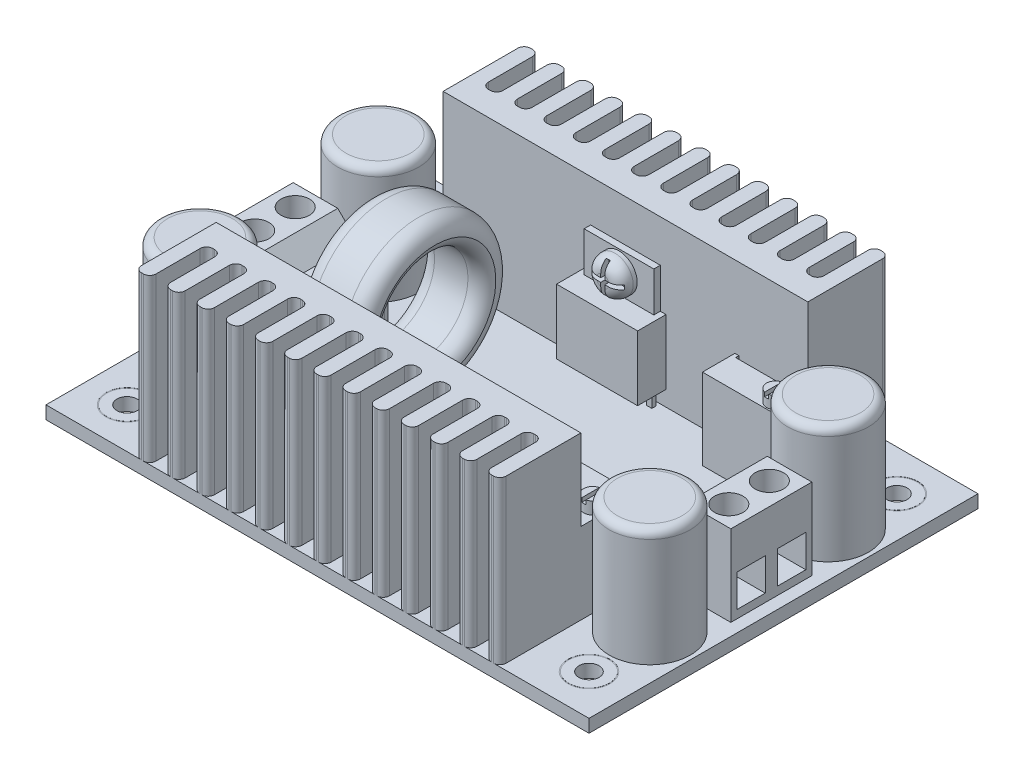
from build123d import *

# Parameters (mm, degrees)
SKETCH1_W                = 67
SKETCH1_H                = 48
BOSS_EXTRUDE1_DEPTH      = 1.6
BOSS_EXTRUDE2_DEPTH      = 20
SKETCH4_R                = 4.999999999999993
SKETCH4_R_2              = 5.000000000000001
SKETCH4_R_3              = 4.9999999999999964
BOSS_EXTRUDE3_DEPTH      = 16
FILLET1_R                = 1
SKETCH7_W                = 7.9999999999999964
SKETCH7_H                = 10
BOSS_EXTRUDE4_DEPTH      = 10
CUT_EXTRUDE1_DEPTH       = 6
CHAMFER1_SIZE            = 2.5
SKETCH9_R                = 1.7500000000000002
CUT_EXTRUDE2_DEPTH       = 6
CHAMFER1_OF_MIRROR1_SIZE = 2.5
BOSS_EXTRUDE5_DEPTH      = 10
CUT_EXTRUDE3_DEPTH       = 10
SKETCH13_R               = 1.0999999999999992
BOSS_EXTRUDE6_DEPTH      = 1.5
SKETCH14_W               = 0.5000000000000036
SKETCH14_H               = 2.4064882157904393
CUT_EXTRUDE4_DEPTH       = 0.5
SKETCH15_R               = 1.2500000000000013
CUT_EXTRUDE5_DEPTH       = 2
SKETCH17_W               = 10
SKETCH17_H               = 8
BOSS_EXTRUDE7_DEPTH      = 3.5
SKETCH19_W               = 0.8000000000000025
SKETCH19_H               = 4.916845402432045
BOSS_EXTRUDE8_DEPTH      = 10
BOSS_EXTRUDE9_DEPTH      = 2
FILLET2_R                = 1.5
CUT_EXTRUDE6_DEPTH       = 1
SKETCH23_W               = 0.6909441831031033
SKETCH23_H               = 0.5
SKETCH23_W_2             = 0.6909441831031198
BOSS_EXTRUDE10_DEPTH     = 4.5
SKETCH25_W               = 0.8000000000000025
SKETCH25_H               = 4.916845402432045
CUT_EXTRUDE7_DEPTH       = 0.7
LPATTERN2_COUNT          = 2
LPATTERN2_PITCH          = 9.3
MIRROR4_START            = -14
MIRROR4_OUTLINE_W        = 10
MIRROR4_OUTLINE_H        = 8
MIRROR4_DEPTH            = 3.5
MIRROR4_2_OUTLINE_R      = 2.25
MIRROR4_2_DEPTH          = 2.8
MIRROR4_3_OUTLINE_W      = 8.6
MIRROR4_3_OUTLINE_H      = 4.916845402
MIRROR4_3_OUTLINE_R      = 2.25
MIRROR4_3_DEPTH          = 0.8
MIRROR4_START_2          = -13.2
MIRROR4_4_DEPTH          = 1
MIRROR4_START_3          = -0.345472092
MIRROR4_5_OUTLINE_W      = 1.9000000000000004
MIRROR4_5_OUTLINE_H      = 0.5
MIRROR4_5_OUTLINE_W_2    = 1
MIRROR4_5_DEPTH          = 0.690944184
MIRROR4_START_4          = -4.264386214
MIRROR4_6_OUTLINE_W      = 1.9000000000000004
MIRROR4_6_OUTLINE_H      = 0.5
MIRROR4_6_OUTLINE_W_2    = 1
MIRROR4_6_DEPTH          = 0.690944183
MIRROR4_START_5          = 3.573442031
MIRROR4_7_OUTLINE_W      = 1.9000000000000004
MIRROR4_7_OUTLINE_H      = 0.5
MIRROR4_7_OUTLINE_W_2    = 1
MIRROR4_7_DEPTH          = 0.690944183
SKETCH28_R               = 9.5
SKETCH28_R_2             = 6
BOSS_EXTRUDE11_DEPTH     = 8
FILLET10_R               = 2
FILLET11_R               = 2
BOSS_EXTRUDE12_DEPTH     = 8
SKETCH32_W               = 11
SKETCH32_H               = 3.5000000000000004
BOSS_EXTRUDE13_DEPTH     = 1.1
BOSS_EXTRUDE14_DEPTH     = 0.4
BOSS_EXTRUDE14_2_DEPTH   = 0.4
LPATTERN3_COUNT          = 8
LPATTERN3_PITCH          = 1.514
BOSS_EXTRUDE15_DEPTH     = 0.4
SKETCH36_W               = 2.4999999999999964
SKETCH36_H               = 1.5
CUT_EXTRUDE8_DEPTH       = 0.2
SKETCH37_R               = 2.5999999999999983
SKETCH37_R_2             = 2.4999999999999982
CUT_EXTRUDE9_DEPTH       = 0.01
MIRROR6_START            = 1.59
MIRROR6_OUTLINE_R        = 2.6
MIRROR6_OUTLINE_R_2      = 2.5
MIRROR6_DEPTH            = 1.41


with BuildPart() as part:
    # Sketch1 → Boss-Extrude1 (new body)
    with BuildSketch(Plane(origin=(0, 0, 0), x_dir=(1, 0, 0), z_dir=(0, 1, 0))):
        Rectangle(SKETCH1_W, SKETCH1_H)
    extrude(amount=BOSS_EXTRUDE1_DEPTH)

    # Sketch2 → Boss-Extrude2 (add)
    with BuildSketch(Plane(origin=(0, 1.6, 0), x_dir=(1, 0, 0), z_dir=(0, 1, 0))):
        with BuildLine():
            Line((-22.49999999999999, -13.999999999999995), (-22.49999999999999, -23.21917648162625))
            ThreePointArc((-22.49999999999999, -23.21917648162625), (-22.27130208637826, -23.771302086378263), (-21.719176481626246, -23.999999999999993))
            Line((-21.719176481626246, -23.999999999999993), (-21.480823518373725, -23.999999999999993))
            ThreePointArc((-21.480823518373725, -23.999999999999993), (-20.92869791362171, -23.771302086378263), (-20.69999999999998, -23.21917648162625))
            Line((-20.69999999999998, -23.21917648162625), (-20.69999999999998, -17.780823518373737))
            ThreePointArc((-20.69999999999998, -17.780823518373737), (-20.47130208637825, -17.228697913621723), (-19.919176481626238, -16.999999999999993))
            Line((-19.919176481626238, -16.999999999999993), (-19.680823518373717, -16.999999999999993))
            ThreePointArc((-19.680823518373717, -16.999999999999993), (-19.128697913621703, -17.228697913621723), (-18.899999999999977, -17.780823518373737))
            Line((-18.899999999999977, -17.780823518373737), (-18.899999999999977, -23.21917648162625))
            ThreePointArc((-18.899999999999977, -23.21917648162625), (-18.671302086378248, -23.771302086378263), (-18.119176481626234, -23.999999999999993))
            Line((-18.119176481626234, -23.999999999999993), (-17.880823518373713, -23.999999999999993))
            ThreePointArc((-17.880823518373713, -23.999999999999993), (-17.3286979136217, -23.771302086378263), (-17.099999999999966, -23.21917648162625))
            Line((-17.099999999999966, -23.21917648162625), (-17.099999999999966, -17.780823518373737))
            ThreePointArc((-17.099999999999966, -17.780823518373737), (-16.87130208637824, -17.228697913621723), (-16.319176481626226, -16.999999999999993))
            Line((-16.319176481626226, -16.999999999999993), (-16.080823518373705, -16.999999999999993))
            ThreePointArc((-16.080823518373705, -16.999999999999993), (-15.528697913621691, -17.228697913621723), (-15.299999999999963, -17.780823518373737))
            Line((-15.299999999999963, -17.780823518373737), (-15.299999999999963, -23.21917648162625))
            ThreePointArc((-15.299999999999963, -23.21917648162625), (-15.071302086378232, -23.771302086378263), (-14.51917648162622, -23.999999999999993))
            Line((-14.51917648162622, -23.999999999999993), (-14.2808235183737, -23.999999999999993))
            ThreePointArc((-14.2808235183737, -23.999999999999993), (-13.728697913621689, -23.77130208637826), (-13.499999999999956, -23.21917648162625))
            Line((-13.499999999999957, -23.21917648162625), (-13.499999999999957, -17.780823518373737))
            ThreePointArc((-13.499999999999957, -17.780823518373737), (-13.271302086378228, -17.228697913621723), (-12.719176481626214, -16.999999999999993))
            Line((-12.719176481626214, -16.999999999999993), (-12.480823518373693, -16.999999999999993))
            ThreePointArc((-12.480823518373693, -16.999999999999993), (-11.92869791362168, -17.228697913621723), (-11.69999999999995, -17.780823518373737))
            Line((-11.69999999999995, -17.780823518373737), (-11.69999999999995, -23.21917648162625))
            ThreePointArc((-11.69999999999995, -23.21917648162625), (-11.47130208637822, -23.771302086378263), (-10.919176481626208, -23.999999999999993))
            Line((-10.919176481626208, -23.999999999999993), (-10.680823518373687, -23.999999999999993))
            ThreePointArc((-10.680823518373687, -23.999999999999993), (-10.128697913621675, -23.771302086378263), (-9.899999999999944, -23.21917648162625))
            Line((-9.899999999999944, -23.21917648162625), (-9.899999999999944, -17.780823518373737))
            ThreePointArc((-9.899999999999944, -17.780823518373737), (-9.671302086378212, -17.228697913621723), (-9.1191764816262, -16.999999999999993))
            Line((-9.1191764816262, -16.999999999999993), (-8.88082351837368, -16.999999999999993))
            ThreePointArc((-8.88082351837368, -16.999999999999993), (-8.328697913621667, -17.228697913621723), (-8.099999999999937, -17.780823518373737))
            Line((-8.099999999999937, -17.780823518373737), (-8.099999999999937, -23.21917648162625))
            ThreePointArc((-8.099999999999937, -23.21917648162625), (-7.871302086378208, -23.771302086378263), (-7.319176481626194, -23.999999999999993))
            Line((-7.319176481626194, -23.999999999999993), (-7.080823518373673, -23.999999999999993))
            ThreePointArc((-7.080823518373673, -23.999999999999993), (-6.52869791362166, -23.771302086378263), (-6.299999999999931, -23.21917648162625))
            Line((-6.2999999999999305, -23.21917648162625), (-6.2999999999999305, -17.780823518373737))
            ThreePointArc((-6.2999999999999305, -17.780823518373737), (-6.071302086378202, -17.228697913621723), (-5.519176481626188, -16.999999999999993))
            Line((-5.519176481626188, -16.999999999999993), (-5.280823518373667, -16.999999999999993))
            ThreePointArc((-5.280823518373667, -16.999999999999993), (-4.728697913621653, -17.228697913621723), (-4.4999999999999245, -17.780823518373737))
            Line((-4.499999999999924, -17.780823518373737), (-4.4999999999999245, -23.21917648162625))
            ThreePointArc((-4.499999999999924, -23.21917648162625), (-4.271302086378195, -23.771302086378263), (-3.719176481626181, -23.999999999999993))
            Line((-3.719176481626181, -23.999999999999993), (-3.480823518373661, -23.999999999999993))
            ThreePointArc((-3.480823518373661, -23.999999999999993), (-2.9286979136216473, -23.771302086378263), (-2.6999999999999185, -23.21917648162625))
            Line((-2.6999999999999176, -23.21917648162625), (-2.6999999999999176, -17.780823518373737))
            ThreePointArc((-2.6999999999999167, -17.780823518373737), (-2.471302086378188, -17.228697913621723), (-1.9191764816261745, -16.999999999999993))
            Line((-1.9191764816261745, -16.999999999999993), (-1.6808235183736544, -16.999999999999993))
            ThreePointArc((-1.6808235183736544, -16.999999999999993), (-1.1286979136216408, -17.228697913621723), (-0.8999999999999115, -17.780823518373737))
            Line((-0.8999999999999113, -17.780823518373737), (-0.8999999999999113, -23.21917648162625))
            ThreePointArc((-0.8999999999999106, -23.21917648162625), (-0.6713020863781813, -23.771302086378263), (-0.11917648162616812, -23.999999999999993))
            Line((-0.11917648162616812, -23.999999999999993), (0.119176481626352, -23.999999999999993))
            ThreePointArc((0.11917648162635198, -23.999999999999993), (0.6713020863783651, -23.771302086378263), (0.9000000000000942, -23.21917648162625))
            Line((0.9000000000000952, -23.21917648162625), (0.9000000000000952, -17.780823518373737))
            ThreePointArc((0.9000000000000954, -17.780823518373737), (1.1286979136218247, -17.228697913621723), (1.6808235183738385, -16.999999999999993))
            Line((1.6808235183738385, -16.999999999999993), (1.9191764816263583, -16.999999999999993))
            ThreePointArc((1.9191764816263583, -16.999999999999993), (2.471302086378372, -17.228697913621723), (2.7000000000001014, -17.780823518373737))
            Line((2.7000000000001014, -17.780823518373737), (2.7000000000001014, -23.21917648162625))
            ThreePointArc((2.700000000000102, -23.21917648162625), (2.928697913621831, -23.771302086378263), (3.4808235183738447, -23.999999999999993))
            Line((3.4808235183738447, -23.999999999999993), (3.719176481626365, -23.999999999999993))
            ThreePointArc((3.719176481626365, -23.999999999999993), (4.271302086378379, -23.771302086378263), (4.5000000000001075, -23.21917648162625))
            Line((4.500000000000108, -23.21917648162625), (4.5000000000001075, -17.780823518373737))
            ThreePointArc((4.500000000000108, -17.780823518373737), (4.728697913621838, -17.228697913621723), (5.280823518373851, -16.999999999999993))
            Line((5.280823518373851, -16.999999999999993), (5.5191764816263715, -16.999999999999993))
            ThreePointArc((5.5191764816263715, -16.999999999999993), (6.071302086378385, -17.228697913621723), (6.300000000000114, -17.780823518373737))
            Line((6.3000000000001135, -17.780823518373737), (6.300000000000114, -23.21917648162625))
            ThreePointArc((6.300000000000115, -23.21917648162625), (6.528697913621844, -23.771302086378263), (7.080823518373858, -23.999999999999993))
            Line((7.080823518373858, -23.999999999999993), (7.319176481626378, -23.999999999999993))
            ThreePointArc((7.319176481626378, -23.999999999999993), (7.871302086378391, -23.771302086378263), (8.10000000000012, -23.21917648162625))
            Line((8.10000000000012, -23.21917648162625), (8.100000000000119, -17.780823518373737))
            ThreePointArc((8.100000000000119, -17.780823518373737), (8.328697913621852, -17.228697913621723), (8.880823518373864, -16.999999999999993))
            Line((8.880823518373864, -16.999999999999993), (9.119176481626385, -16.999999999999993))
            ThreePointArc((9.119176481626385, -16.999999999999993), (9.671302086378397, -17.228697913621723), (9.900000000000126, -17.780823518373737))
            Line((9.900000000000126, -17.780823518373737), (9.900000000000128, -23.21917648162625))
            ThreePointArc((9.900000000000128, -23.21917648162625), (10.128697913621856, -23.771302086378263), (10.68082351837387, -23.999999999999993))
            Line((10.68082351837387, -23.999999999999993), (10.91917648162639, -23.999999999999993))
            ThreePointArc((10.91917648162639, -23.999999999999993), (11.471302086378405, -23.771302086378263), (11.700000000000134, -23.21917648162625))
            Line((11.700000000000134, -23.21917648162625), (11.700000000000136, -17.780823518373737))
            ThreePointArc((11.700000000000138, -17.780823518373737), (11.928697913621864, -17.228697913621723), (12.480823518373876, -16.999999999999993))
            Line((12.480823518373876, -16.999999999999993), (12.7191764816264, -16.999999999999993))
            ThreePointArc((12.7191764816264, -16.999999999999993), (13.271302086378412, -17.228697913621723), (13.500000000000144, -17.780823518373737))
            Line((13.500000000000144, -17.780823518373737), (13.500000000000144, -23.21917648162625))
            ThreePointArc((13.500000000000144, -23.21917648162625), (13.728697913621875, -23.771302086378263), (14.280823518373888, -23.999999999999993))
            Line((14.280823518373888, -23.999999999999993), (14.51917648162641, -23.999999999999993))
            ThreePointArc((14.51917648162641, -23.999999999999993), (15.071302086378424, -23.771302086378263), (15.300000000000153, -23.21917648162625))
            Line((15.300000000000153, -23.21917648162625), (15.300000000000153, -17.780823518373737))
            ThreePointArc((15.300000000000153, -17.780823518373737), (15.528697913621885, -17.228697913621723), (16.080823518373897, -16.999999999999993))
            Line((16.080823518373897, -16.999999999999993), (16.319176481626407, -16.999999999999993))
            ThreePointArc((16.319176481626407, -16.999999999999993), (16.87130208637842, -17.228697913621723), (17.10000000000015, -17.780823518373737))
            Line((17.100000000000154, -17.780823518373737), (17.10000000000015, -23.21917648162625))
            ThreePointArc((17.10000000000015, -23.21917648162625), (17.32869791362188, -23.771302086378263), (17.880823518373894, -23.999999999999993))
            Line((17.880823518373894, -23.999999999999993), (18.11917648162642, -23.999999999999993))
            ThreePointArc((18.11917648162642, -23.999999999999993), (18.67130208637843, -23.77130208637826), (18.90000000000016, -23.21917648162625))
            Line((18.90000000000016, -23.21917648162625), (18.90000000000016, -17.780823518373737))
            ThreePointArc((18.90000000000016, -17.780823518373737), (19.128697913621888, -17.228697913621723), (19.680823518373902, -16.999999999999993))
            Line((19.680823518373902, -16.999999999999993), (19.919176481626426, -16.999999999999993))
            ThreePointArc((19.919176481626426, -16.999999999999993), (20.47130208637844, -17.228697913621723), (20.700000000000166, -17.780823518373737))
            Line((20.700000000000166, -17.780823518373737), (20.70000000000017, -23.21917648162625))
            ThreePointArc((20.70000000000017, -23.21917648162625), (20.9286979136219, -23.771302086378263), (21.480823518373914, -23.999999999999993))
            Line((21.480823518373914, -23.999999999999993), (21.719176481626267, -23.999999999999993))
            ThreePointArc((21.719176481626267, -23.999999999999993), (22.27130208637828, -23.771302086378263), (22.50000000000001, -23.21917648162625))
            Line((22.50000000000001, -23.21917648162625), (22.50000000000001, -13.999999999999995))
            Line((22.50000000000001, -13.999999999999995), (-22.49999999999999, -13.999999999999995))
        make_face()
        with BuildLine():
            Line((19.919176481626426, 16.999999999999993), (19.680823518373902, 16.999999999999993))
            ThreePointArc((19.680823518373902, 16.999999999999993), (19.128697913621888, 17.228697913621723), (18.90000000000016, 17.780823518373737))
            Line((18.90000000000016, 17.780823518373737), (18.90000000000016, 23.21917648162625))
            ThreePointArc((18.90000000000016, 23.21917648162625), (18.67130208637843, 23.77130208637826), (18.11917648162642, 23.999999999999993))
            Line((18.11917648162642, 23.999999999999993), (17.880823518373894, 23.999999999999993))
            ThreePointArc((17.880823518373894, 23.999999999999993), (17.32869791362188, 23.771302086378263), (17.10000000000015, 23.21917648162625))
            Line((17.10000000000015, 23.21917648162625), (17.100000000000154, 17.780823518373737))
            ThreePointArc((17.10000000000015, 17.780823518373737), (16.87130208637842, 17.228697913621723), (16.319176481626407, 16.999999999999993))
            Line((16.319176481626407, 16.999999999999993), (16.080823518373897, 16.999999999999993))
            ThreePointArc((16.080823518373897, 16.999999999999993), (15.528697913621885, 17.228697913621723), (15.300000000000153, 17.780823518373737))
            Line((15.300000000000153, 17.780823518373737), (15.300000000000153, 23.21917648162625))
            ThreePointArc((15.300000000000153, 23.21917648162625), (15.071302086378424, 23.771302086378263), (14.51917648162641, 23.999999999999993))
            Line((14.51917648162641, 23.999999999999993), (14.280823518373888, 23.999999999999993))
            ThreePointArc((14.280823518373888, 23.999999999999993), (13.728697913621875, 23.771302086378263), (13.500000000000144, 23.21917648162625))
            Line((13.500000000000144, 23.21917648162625), (13.500000000000144, 17.780823518373737))
            ThreePointArc((13.500000000000144, 17.780823518373737), (13.271302086378412, 17.228697913621723), (12.7191764816264, 16.999999999999993))
            Line((12.7191764816264, 16.999999999999993), (12.480823518373876, 16.999999999999993))
            ThreePointArc((12.480823518373876, 16.999999999999993), (11.928697913621864, 17.228697913621723), (11.700000000000138, 17.780823518373737))
            Line((11.700000000000136, 17.780823518373737), (11.700000000000134, 23.21917648162625))
            ThreePointArc((11.700000000000134, 23.21917648162625), (11.471302086378405, 23.771302086378263), (10.91917648162639, 23.999999999999993))
            Line((10.91917648162639, 23.999999999999993), (10.68082351837387, 23.999999999999993))
            ThreePointArc((10.68082351837387, 23.999999999999993), (10.128697913621856, 23.771302086378263), (9.900000000000128, 23.21917648162625))
            Line((9.900000000000128, 23.21917648162625), (9.900000000000126, 17.780823518373737))
            ThreePointArc((9.900000000000126, 17.780823518373737), (9.671302086378397, 17.228697913621723), (9.119176481626385, 16.999999999999993))
            Line((9.119176481626385, 16.999999999999993), (8.880823518373864, 16.999999999999993))
            ThreePointArc((8.880823518373864, 16.999999999999993), (8.328697913621852, 17.228697913621723), (8.100000000000119, 17.780823518373737))
            Line((8.100000000000119, 17.780823518373737), (8.10000000000012, 23.21917648162625))
            ThreePointArc((8.10000000000012, 23.21917648162625), (7.871302086378391, 23.771302086378263), (7.319176481626378, 23.999999999999993))
            Line((7.319176481626378, 23.999999999999993), (7.080823518373858, 23.999999999999993))
            ThreePointArc((7.080823518373858, 23.999999999999993), (6.528697913621844, 23.771302086378263), (6.300000000000115, 23.21917648162625))
            Line((6.300000000000114, 23.21917648162625), (6.3000000000001135, 17.780823518373737))
            ThreePointArc((6.300000000000114, 17.780823518373737), (6.071302086378385, 17.228697913621723), (5.5191764816263715, 16.999999999999993))
            Line((5.5191764816263715, 16.999999999999993), (5.280823518373851, 16.999999999999993))
            ThreePointArc((5.280823518373851, 16.999999999999993), (4.728697913621838, 17.228697913621723), (4.500000000000108, 17.780823518373737))
            Line((4.5000000000001075, 17.780823518373737), (4.500000000000108, 23.21917648162625))
            ThreePointArc((4.5000000000001075, 23.21917648162625), (4.271302086378379, 23.771302086378263), (3.719176481626365, 23.999999999999993))
            Line((3.719176481626365, 23.999999999999993), (3.4808235183738447, 23.999999999999993))
            ThreePointArc((3.4808235183738447, 23.999999999999993), (2.928697913621831, 23.771302086378263), (2.700000000000102, 23.21917648162625))
            Line((2.7000000000001014, 23.21917648162625), (2.7000000000001014, 17.780823518373737))
            ThreePointArc((2.7000000000001014, 17.780823518373737), (2.471302086378372, 17.228697913621723), (1.9191764816263583, 16.999999999999993))
            Line((1.9191764816263583, 16.999999999999993), (1.6808235183738385, 16.999999999999993))
            ThreePointArc((1.6808235183738385, 16.999999999999993), (1.1286979136218251, 17.228697913621723), (0.9000000000000957, 17.780823518373737))
            Line((0.9000000000000952, 17.780823518373737), (0.9000000000000952, 23.21917648162625))
            ThreePointArc((0.9000000000000942, 23.21917648162625), (0.6713020863783651, 23.771302086378263), (0.11917648162635198, 23.999999999999993))
            Line((0.119176481626352, 23.999999999999993), (-0.11917648162616812, 23.999999999999993))
            ThreePointArc((-0.11917648162616812, 23.999999999999993), (-0.6713020863781813, 23.771302086378263), (-0.8999999999999106, 23.21917648162625))
            Line((-0.8999999999999113, 23.21917648162625), (-0.8999999999999113, 17.780823518373737))
            ThreePointArc((-0.8999999999999115, 17.780823518373737), (-1.1286979136216408, 17.228697913621723), (-1.6808235183736544, 16.999999999999993))
            Line((-1.6808235183736544, 16.999999999999993), (-1.9191764816261745, 16.999999999999993))
            ThreePointArc((-1.9191764816261745, 16.999999999999993), (-2.471302086378188, 17.228697913621723), (-2.6999999999999167, 17.780823518373737))
            Line((-2.6999999999999176, 17.780823518373737), (-2.6999999999999176, 23.21917648162625))
            ThreePointArc((-2.6999999999999185, 23.21917648162625), (-2.9286979136216473, 23.771302086378263), (-3.480823518373661, 23.999999999999993))
            Line((-3.480823518373661, 23.999999999999993), (-3.719176481626181, 23.999999999999993))
            ThreePointArc((-3.719176481626181, 23.999999999999993), (-4.271302086378195, 23.771302086378263), (-4.499999999999924, 23.21917648162625))
            Line((-4.4999999999999245, 23.21917648162625), (-4.499999999999924, 17.780823518373737))
            ThreePointArc((-4.4999999999999245, 17.780823518373737), (-4.728697913621653, 17.228697913621723), (-5.280823518373667, 16.999999999999993))
            Line((-5.280823518373667, 16.999999999999993), (-5.519176481626188, 16.999999999999993))
            ThreePointArc((-5.519176481626188, 16.999999999999993), (-6.071302086378202, 17.228697913621723), (-6.2999999999999305, 17.780823518373737))
            Line((-6.2999999999999305, 17.780823518373737), (-6.2999999999999305, 23.21917648162625))
            ThreePointArc((-6.299999999999931, 23.21917648162625), (-6.52869791362166, 23.771302086378263), (-7.080823518373673, 23.999999999999993))
            Line((-7.080823518373673, 23.999999999999993), (-7.319176481626194, 23.999999999999993))
            ThreePointArc((-7.319176481626194, 23.999999999999993), (-7.871302086378208, 23.771302086378263), (-8.099999999999937, 23.21917648162625))
            Line((-8.099999999999937, 23.21917648162625), (-8.099999999999937, 17.780823518373737))
            ThreePointArc((-8.099999999999937, 17.780823518373737), (-8.328697913621667, 17.228697913621723), (-8.88082351837368, 16.999999999999993))
            Line((-8.88082351837368, 16.999999999999993), (-9.1191764816262, 16.999999999999993))
            ThreePointArc((-9.1191764816262, 16.999999999999993), (-9.671302086378212, 17.228697913621723), (-9.899999999999944, 17.780823518373737))
            Line((-9.899999999999944, 17.780823518373737), (-9.899999999999944, 23.21917648162625))
            ThreePointArc((-9.899999999999944, 23.21917648162625), (-10.128697913621675, 23.771302086378263), (-10.680823518373687, 23.999999999999993))
            Line((-10.680823518373687, 23.999999999999993), (-10.919176481626208, 23.999999999999993))
            ThreePointArc((-10.919176481626208, 23.999999999999993), (-11.47130208637822, 23.771302086378263), (-11.69999999999995, 23.21917648162625))
            Line((-11.69999999999995, 23.21917648162625), (-11.69999999999995, 17.780823518373737))
            ThreePointArc((-11.69999999999995, 17.780823518373737), (-11.92869791362168, 17.228697913621723), (-12.480823518373693, 16.999999999999993))
            Line((-12.480823518373693, 16.999999999999993), (-12.719176481626214, 16.999999999999993))
            ThreePointArc((-12.719176481626214, 16.999999999999993), (-13.271302086378228, 17.228697913621723), (-13.499999999999957, 17.780823518373737))
            Line((-13.499999999999957, 17.780823518373737), (-13.499999999999957, 23.21917648162625))
            ThreePointArc((-13.499999999999956, 23.21917648162625), (-13.728697913621689, 23.77130208637826), (-14.2808235183737, 23.999999999999993))
            Line((-14.2808235183737, 23.999999999999993), (-14.51917648162622, 23.999999999999993))
            ThreePointArc((-14.51917648162622, 23.999999999999993), (-15.071302086378232, 23.771302086378263), (-15.299999999999963, 23.21917648162625))
            Line((-15.299999999999963, 23.21917648162625), (-15.299999999999963, 17.780823518373737))
            ThreePointArc((-15.299999999999963, 17.780823518373737), (-15.528697913621691, 17.228697913621723), (-16.080823518373705, 16.999999999999993))
            Line((-16.080823518373705, 16.999999999999993), (-16.319176481626226, 16.999999999999993))
            ThreePointArc((-16.319176481626226, 16.999999999999993), (-16.87130208637824, 17.228697913621723), (-17.099999999999966, 17.780823518373737))
            Line((-17.099999999999966, 17.780823518373737), (-17.099999999999966, 23.21917648162625))
            ThreePointArc((-17.099999999999966, 23.21917648162625), (-17.3286979136217, 23.771302086378263), (-17.880823518373713, 23.999999999999993))
            Line((-17.880823518373713, 23.999999999999993), (-18.119176481626234, 23.999999999999993))
            ThreePointArc((-18.119176481626234, 23.999999999999993), (-18.671302086378248, 23.771302086378263), (-18.899999999999977, 23.21917648162625))
            Line((-18.899999999999977, 23.21917648162625), (-18.899999999999977, 17.780823518373737))
            ThreePointArc((-18.899999999999977, 17.780823518373737), (-19.128697913621703, 17.228697913621723), (-19.680823518373717, 16.999999999999993))
            Line((-19.680823518373717, 16.999999999999993), (-19.919176481626238, 16.999999999999993))
            ThreePointArc((-19.919176481626238, 16.999999999999993), (-20.47130208637825, 17.228697913621723), (-20.69999999999998, 17.780823518373737))
            Line((-20.69999999999998, 17.780823518373737), (-20.69999999999998, 23.21917648162625))
            ThreePointArc((-20.69999999999998, 23.21917648162625), (-20.92869791362171, 23.771302086378263), (-21.480823518373725, 23.999999999999993))
            Line((-21.480823518373725, 23.999999999999993), (-21.719176481626246, 23.999999999999993))
            ThreePointArc((-21.719176481626246, 23.999999999999993), (-22.27130208637826, 23.771302086378263), (-22.49999999999999, 23.21917648162625))
            Line((-22.49999999999999, 23.21917648162625), (-22.49999999999999, 13.999999999999995))
            Line((-22.49999999999999, 13.999999999999995), (22.50000000000001, 13.999999999999995))
            Line((22.50000000000001, 13.999999999999995), (22.50000000000001, 23.21917648162625))
            ThreePointArc((22.50000000000001, 23.21917648162625), (22.27130208637828, 23.771302086378263), (21.719176481626267, 23.999999999999993))
            Line((21.719176481626267, 23.999999999999993), (21.480823518373914, 23.999999999999993))
            ThreePointArc((21.480823518373914, 23.999999999999993), (20.9286979136219, 23.771302086378263), (20.70000000000017, 23.21917648162625))
            Line((20.70000000000017, 23.21917648162625), (20.700000000000166, 17.780823518373737))
            ThreePointArc((20.700000000000166, 17.780823518373737), (20.47130208637844, 17.228697913621723), (19.919176481626426, 16.999999999999993))
        make_face()
    extrude(amount=BOSS_EXTRUDE2_DEPTH)

    # Sketch4 → Boss-Extrude3 (add)
    with BuildSketch(Plane(origin=(0, 0, 0), x_dir=(1, 0, 0), z_dir=(0, 1, 0))):
        with Locations(Location((28.000000000000014, -11.000000000000002, 0), (0, 0, 90))):
            Circle(SKETCH4_R)
        with Locations(Location((-27.499999999999996, -11.000000000000002, 0), (0, 0, 90))):
            Circle(SKETCH4_R_2)
        with Locations(Location((-27.499999999999996, 11.000000000000002, 0), (0, 0, 90))):
            Circle(SKETCH4_R_2)
        with Locations(Location((28.00000000000001, 11.000000000000002, 0), (0, 0, 90))):
            Circle(SKETCH4_R_3)
    extrude(amount=BOSS_EXTRUDE3_DEPTH)

    # Fillet1
    fillet1_edges = [part.edges().sort_by_distance(p)[0] for p in [
        (28.000000000000014, 16, 15.999999999999995),
        (28.00000000000001, 16, -6.000000000000005),
        (-27.499999999999996, 16, -6.000000000000001),
        (-27.499999999999996, 16, 16.000000000000004),
    ]]
    fillet(fillet1_edges, radius=FILLET1_R)

    # Sketch7 → Boss-Extrude4 (add)
    with BuildSketch(Plane(origin=(0, 1.6, 0), x_dir=(1, 0, 0), z_dir=(0, 1, 0))):
        with Locations((28.000000000000007, 0)):
            Rectangle(SKETCH7_W, SKETCH7_H)
    boss_extrude4 = extrude(amount=BOSS_EXTRUDE4_DEPTH)

    # Sketch8 → Cut-Extrude1 (cut)
    with BuildSketch(Plane(origin=(32.00000000000001, 0, 0), x_dir=(0, 0, -1), z_dir=(1, 0, 0))):
        Polygon((4.250000000000001, 6.600000000000001), (0.7500000000000009, 6.600000000000001), (0.750000000000002, 2.6000000000000014), (4.250000000000002, 2.6000000000000023), align=None)
        Polygon((-0.75, 6.600000000000001), (-4.25, 6.6000000000000005), (-4.25, 2.6000000000000014), (-0.75, 2.6000000000000014), align=None)
    cut_extrude1 = extrude(amount=-CUT_EXTRUDE1_DEPTH, mode=Mode.SUBTRACT)

    # Chamfer1
    chamfer1_edges = [part.edges().sort_by_distance(p)[0] for p in [
        (24.000000000000014, 11.6, 0),
    ]]
    chamfer(chamfer1_edges, length=CHAMFER1_SIZE)

    # Sketch9 → Cut-Extrude2 (cut)
    with BuildSketch(Plane(origin=(0, 11.600000000000001, 0), x_dir=(1, 0, 0), z_dir=(0, 1, 0))):
        with BuildLine():
            ThreePointArc((29.25000000000003, 4.25), (27.500000000000014, 2.5), (29.25000000000003, 0.7499999999999998))
            Line((29.250000000000014, 0.7499999999999998), (29.250000000000014, 4.25))
        make_face()
        with BuildLine():
            Line((29.250000000000014, 4.25), (29.250000000000014, 0.7499999999999998))
            ThreePointArc((29.25000000000003, 0.7499999999999998), (30.48743686707648, 1.262563132923547), (31.000000000000014, 2.4999999999999996))
            ThreePointArc((31.000000000000014, 2.5), (30.48743686707648, 3.737436867076453), (29.25000000000003, 4.25))
        make_face()
        with Locations(Location((29.250000000000014, -2.500000000000001, 0), (0, 0, 270))):
            Circle(SKETCH9_R)
    cut_extrude2 = extrude(amount=-CUT_EXTRUDE2_DEPTH, mode=Mode.SUBTRACT)

    # Mirror1: Boss-Extrude4, Cut-Extrude1, Cut-Extrude2 across plane
    add(boss_extrude4.mirror(Plane(origin=(0, 0, 0), x_dir=(0, 0, 1), z_dir=(1, 0, 0))))
    add(cut_extrude1.mirror(Plane(origin=(0, 0, 0), x_dir=(0, 0, 1), z_dir=(1, 0, 0))), mode=Mode.SUBTRACT)
    add(cut_extrude2.mirror(Plane(origin=(0, 0, 0), x_dir=(0, 0, 1), z_dir=(1, 0, 0))), mode=Mode.SUBTRACT)

    # Chamfer1 of Mirror1
    chamfer1_of_mirror1_edges = [part.edges().sort_by_distance(p)[0] for p in [
        (-24.000000000000014, 11.6, 0),
    ]]
    chamfer(chamfer1_of_mirror1_edges, length=CHAMFER1_OF_MIRROR1_SIZE)

    # Sketch11 → Boss-Extrude5 (add)
    with BuildSketch(Plane(origin=(0, 1.6, 0), x_dir=(1, 0, 0), z_dir=(0, 1, 0))):
        Polygon((22.50000000000001, 13.999999999999995), (13.50000000000001, 13.999999999999993), (13.50000000000001, 9.999999999999993), (22.50000000000001, 9.999999999999995), align=None)
    boss_extrude5 = extrude(amount=BOSS_EXTRUDE5_DEPTH)

    # Sketch12 → Cut-Extrude3 (cut)
    with BuildSketch(Plane(origin=(0, 11.600000000000001, 0), x_dir=(1, 0, 0), z_dir=(0, 1, 0))):
        Polygon((14.00000000000001, 13.999999999999995), (22.000000000000014, 13.999999999999995), (22.00000000000001, 13.599999999999996), (14.00000000000001, 13.599999999999996), align=None)
    cut_extrude3 = extrude(amount=-CUT_EXTRUDE3_DEPTH, mode=Mode.SUBTRACT)

    # Sketch13 → Boss-Extrude6 (add)
    with BuildSketch(Plane(origin=(0, 11.600000000000001, 0), x_dir=(1, 0, 0), z_dir=(0, 1, 0))):
        with Locations(Location((21.227207793864224, 11.272792206135781, 0), (0, 0, 90))):
            Circle(SKETCH13_R)
    boss_extrude6 = extrude(amount=BOSS_EXTRUDE6_DEPTH)

    # Sketch14 → Cut-Extrude4 (cut)
    with BuildSketch(Plane(origin=(0, 13.100000000000001, 0), x_dir=(1, 0, 0), z_dir=(0, 1, 0))):
        with Locations((21.227207793864224, 11.27279220613578)):
            Rectangle(SKETCH14_W, SKETCH14_H)
    cut_extrude4 = extrude(amount=-CUT_EXTRUDE4_DEPTH, mode=Mode.SUBTRACT)

    # Mirror2: Boss-Extrude5, Cut-Extrude3, Boss-Extrude6, Cut-Extrude4 across plane
    add(boss_extrude5.mirror(Plane.XY))
    add(cut_extrude3.mirror(Plane.XY), mode=Mode.SUBTRACT)
    add(boss_extrude6.mirror(Plane.XY))
    add(cut_extrude4.mirror(Plane.XY), mode=Mode.SUBTRACT)

    # Sketch15 → Cut-Extrude5 (cut)
    with BuildSketch(Plane(origin=(0, 1.6, 0), x_dir=(1, 0, 0), z_dir=(0, 1, 0))):
        with Locations(Location((28.500000000000007, 19, 0), (0, 0, 270))):
            Circle(SKETCH15_R)
        with Locations(Location((-28.500000000000007, 19, 0), (0, 0, 270))):
            Circle(SKETCH15_R)
        with Locations(Location((-28.500000000000007, -19, 0), (0, 0, 270))):
            Circle(SKETCH15_R)
        with Locations(Location((28.500000000000007, -19, 0), (0, 0, 270))):
            Circle(SKETCH15_R)
    extrude(amount=-CUT_EXTRUDE5_DEPTH, mode=Mode.SUBTRACT)

    # Sketch17 → Boss-Extrude7 (add)
    with BuildSketch(Plane(origin=(0, 0, 13.999999999999995), x_dir=(-1, 0, 0), z_dir=(0, 0, -1))):
        with Locations((8.9e-16, 7.5)):
            Rectangle(SKETCH17_W, SKETCH17_H)
    extrude(amount=BOSS_EXTRUDE7_DEPTH)



with BuildPart() as body_2:
    # Sketch19 → Boss-Extrude8 (new body)
    with BuildSketch(Plane.ZY.offset(5.000000000000001)):
        with Locations((13.599999999999994, 13.958422701216023)):
            Rectangle(SKETCH19_W, SKETCH19_H)
    extrude(amount=-BOSS_EXTRUDE8_DEPTH)


with BuildPart() as part_1:
    add(part.part)

    add(body_2.part)  # Boss-Extrude9 merges body 2
    # Sketch20 → Boss-Extrude9 (add)
    with BuildSketch(Plane(origin=(0, 0, 13.199999999999994), x_dir=(-1, 0, 0), z_dir=(0, 0, -1))):
        with BuildLine():
            ThreePointArc((2.250000000000001, 13.958422701216023), (0.5096332953407618, 16.149945893947535), (-2.0191323593601025, 14.951198867018215))
            Line((-2.0191323593601194, 14.95119886701818), (2.0191323593601194, 12.965646535413866))
            ThreePointArc((2.0191323593600976, 12.965646535413816), (2.1915231927315104, 13.448789405875255), (2.250000000000001, 13.958422701216023))
        make_face()
        with BuildLine():
            Line((2.0191323593601194, 12.965646535413866), (-2.0191323593601194, 14.95119886701818))
            ThreePointArc((-2.0191323593601025, 14.951198867018215), (-0.9927761658021982, 11.939290341855923), (2.0191323593600976, 12.965646535413816))
        make_face()
    extrude(amount=BOSS_EXTRUDE9_DEPTH)

    # Fillet2
    fillet2_edges = [part_1.edges().sort_by_distance(p)[0] for p in [
        (-2.0191323593601136, 12.965646535413851, 11.199999999999994),
    ]]
    fillet(fillet2_edges, radius=FILLET2_R)

    # Sketch22 → Cut-Extrude6 (cut)
    with BuildSketch(Plane(origin=(0, 0, 11.199999999999994), x_dir=(-1, 0, 0), z_dir=(0, 0, -1))):
        Polygon((-0.24999999999999925, 14.208422701216023), (-0.24999999999999925, 13.708422701216023), (0.2500000000000009, 13.708422701216023), (0.2500000000000008, 14.208422701216023), align=None)
        with BuildLine():
            Line((-0.24999999999999925, 15.958422701216023), (-0.24999999999999925, 14.665529482402576))
            ThreePointArc((-0.24999999999999015, 14.665529482402572), (6.58e-15, 14.708422701216023), (0.2500000000000025, 14.665529482402569))
            Line((0.2500000000000008, 14.665529482402569), (0.2500000000000008, 15.958422701216023))
            Line((0.2500000000000008, 15.958422701216023), (-0.24999999999999925, 15.958422701216023))
        make_face()
        with BuildLine():
            ThreePointArc((0.7500000000000007, 13.958422701216023), (0.7391989197401155, 13.831596217171692), (0.7071067811865417, 13.708422701216005))
            Line((0.7071067811865368, 13.708422701216023), (2.000000000000001, 13.708422701216023))
            Line((2.000000000000001, 13.708422701216023), (2.000000000000001, 14.208422701216023))
            Line((2.000000000000001, 14.208422701216023), (0.7071067811865364, 14.208422701216023))
            ThreePointArc((0.7071067811865419, 14.20842270121604), (0.7391989197401156, 14.085249185260354), (0.7500000000000007, 13.958422701216023))
        make_face()
        with BuildLine():
            Line((0.2500000000000008, 14.208422701216023), (0.2500000000000008, 13.708422701216023))
            Line((0.2500000000000009, 13.708422701216023), (0.7071067811865368, 13.708422701216023))
            ThreePointArc((0.7071067811865417, 13.708422701216005), (0.7391989197401155, 13.831596217171692), (0.7500000000000007, 13.958422701216023))
            ThreePointArc((0.7500000000000007, 13.958422701216023), (0.7391989197401156, 14.085249185260354), (0.7071067811865419, 14.20842270121604))
            Line((0.7071067811865364, 14.208422701216023), (0.2500000000000009, 14.208422701216023))
        make_face()
        with BuildLine():
            Line((-0.24999999999999925, 13.25131592002947), (-0.24999999999999925, 11.958422701216024))
            Line((-0.24999999999999925, 11.958422701216024), (0.2500000000000008, 11.958422701216024))
            Line((0.2500000000000008, 11.958422701216024), (0.2500000000000008, 13.251315920029477))
            ThreePointArc((0.25000000000000244, 13.251315920029477), (6.72e-15, 13.208422701216023), (-0.24999999999998967, 13.251315920029471))
        make_face()
        with BuildLine():
            Line((-0.24999999999999925, 13.708422701216023), (-0.24999999999999925, 13.25131592002947))
            ThreePointArc((-0.24999999999998967, 13.251315920029471), (6.72e-15, 13.208422701216023), (0.25000000000000244, 13.251315920029477))
            Line((0.2500000000000008, 13.251315920029477), (0.2500000000000008, 13.708422701216023))
            Line((0.2500000000000009, 13.708422701216023), (-0.24999999999999933, 13.708422701216023))
        make_face()
        with BuildLine():
            Line((-1.9999999999999991, 13.708422701216023), (-0.7071067811865359, 13.708422701216023))
            ThreePointArc((-0.7071067811865408, 13.708422701216007), (-0.7499999999999989, 13.958422701216023), (-0.7071067811865408, 14.208422701216039))
            Line((-0.7071067811865359, 14.208422701216023), (-1.9999999999999991, 14.208422701216023))
            Line((-1.9999999999999991, 14.208422701216023), (-1.9999999999999991, 13.708422701216023))
        make_face()
        with BuildLine():
            Line((-0.7071067811865359, 13.708422701216023), (-0.24999999999999933, 13.708422701216023))
            Line((-0.24999999999999925, 13.708422701216023), (-0.24999999999999925, 14.208422701216023))
            Line((-0.24999999999999933, 14.208422701216023), (-0.7071067811865359, 14.208422701216023))
            ThreePointArc((-0.7071067811865408, 14.208422701216039), (-0.7499999999999989, 13.958422701216023), (-0.7071067811865408, 13.708422701216007))
        make_face()
        with BuildLine():
            Line((-0.24999999999999925, 14.665529482402576), (-0.24999999999999925, 14.208422701216023))
            Line((-0.24999999999999933, 14.208422701216023), (0.2500000000000009, 14.208422701216023))
            Line((0.2500000000000008, 14.208422701216023), (0.2500000000000008, 14.665529482402569))
            ThreePointArc((0.2500000000000025, 14.665529482402569), (6.58e-15, 14.708422701216023), (-0.24999999999999015, 14.665529482402572))
        make_face()
    extrude(amount=-CUT_EXTRUDE6_DEPTH, mode=Mode.SUBTRACT)

    # Sketch23 → Boss-Extrude10 (add)
    with BuildSketch(Plane.XZ.offset(-3.4999999999999996)):
        with Locations((-3.9189141228188498, 13.243812391788483)):
            Rectangle(SKETCH23_W, SKETCH23_H)
        with Locations((3.9189141228188413, 13.243812391788483)):
            Rectangle(SKETCH23_W_2, SKETCH23_H)
        Polygon((-0.3454720915515696, 13.493812391788484), (-0.3454720915515696, 12.993812391788483), (0.34547209155153435, 12.993812391788483), (0.345472091551534, 13.493812391788484), align=None)
    extrude(amount=BOSS_EXTRUDE10_DEPTH)

    # Sketch25 → Cut-Extrude7 (cut)
    with BuildSketch(Plane.ZY.offset(5.000000000000001)):
        with Locations((13.599999999999994, 13.958422701216023)):
            Rectangle(SKETCH25_W, SKETCH25_H)
    cut_extrude7 = extrude(amount=-CUT_EXTRUDE7_DEPTH, mode=Mode.SUBTRACT)

    # LPattern2: Cut-Extrude7 ×2
    with Locations(*[(i * LPATTERN2_PITCH, 0, 0) for i in range(1, LPATTERN2_COUNT)]):
        add(cut_extrude7, mode=Mode.SUBTRACT)

    # Mirror4: read off the stored shape, not the designer's step
    # Mirror4 outline → Mirror4 (add)
    with BuildSketch(Plane.XY.offset(MIRROR4_START)):
        with Locations((0, 7.5)):
            Rectangle(MIRROR4_OUTLINE_W, MIRROR4_OUTLINE_H)
    extrude(amount=MIRROR4_DEPTH)

    # Mirror4 2 outline → Mirror4 2 (add)
    with BuildSketch(Plane.XY.offset(MIRROR4_START)):
        with Locations((0, 13.958422701)):
            Circle(MIRROR4_2_OUTLINE_R)
        Polygon((2, 13.708422701), (0.25, 13.708422701), (0.25, 11.958422701), (-0.25, 11.958422701), (-0.25, 13.708422701), (-2, 13.708422701), (-2, 14.208422701), (-0.25, 14.208422701), (-0.25, 15.958422701), (0.25, 15.958422701), (0.25, 14.208422701), (2, 14.208422701), align=None, mode=Mode.SUBTRACT)
    extrude(amount=MIRROR4_2_DEPTH)

    # Mirror4 3 outline → Mirror4 3 (add)
    # profile 1 of 2: a face of its own
    with BuildSketch(Plane.XY.offset(MIRROR4_START)):
        with Locations((0, 13.958422701)):
            Rectangle(MIRROR4_3_OUTLINE_W, MIRROR4_3_OUTLINE_H)
        with Locations((0, 13.958422701)):
            Circle(MIRROR4_3_OUTLINE_R, mode=Mode.SUBTRACT)
    # profile 2 of 2: a face of its own
    with BuildSketch(Plane.XY.offset(MIRROR4_START)):
        Polygon((0.25, 11.958422701), (0.25, 13.708422701), (2, 13.708422701), (2, 14.208422701), (0.25, 14.208422701), (0.25, 15.958422701), (-0.25, 15.958422701), (-0.25, 14.208422701), (-2, 14.208422701), (-2, 13.708422701), (-0.25, 13.708422701), (-0.25, 11.958422701), align=None)
    extrude(amount=MIRROR4_3_DEPTH)

    # Mirror4 4 outline → Mirror4 4 (add)
    with BuildSketch(Plane.XY.offset(MIRROR4_START_2)):
        Polygon((0.25, 11.958422701), (0.25, 13.708422701), (2, 13.708422701), (2, 14.208422701), (0.25, 14.208422701), (0.25, 15.958422701), (-0.25, 15.958422701), (-0.25, 14.208422701), (-2, 14.208422701), (-2, 13.708422701), (-0.25, 13.708422701), (-0.25, 11.958422701), align=None)
    extrude(amount=MIRROR4_4_DEPTH)

    # Mirror4 5 outline → Mirror4 5 (add)
    with BuildSketch(Plane.YZ.offset(MIRROR4_START_3)):
        with Locations((2.5500000000000003, -13.243812392)):
            Rectangle(MIRROR4_5_OUTLINE_W, MIRROR4_5_OUTLINE_H)
        with Locations((-0.5, -13.243812392)):
            Rectangle(MIRROR4_5_OUTLINE_W_2, MIRROR4_5_OUTLINE_H)
    extrude(amount=MIRROR4_5_DEPTH)

    # Mirror4 6 outline → Mirror4 6 (add)
    with BuildSketch(Plane.YZ.offset(MIRROR4_START_4)):
        with Locations((2.5500000000000003, -13.243812392)):
            Rectangle(MIRROR4_6_OUTLINE_W, MIRROR4_6_OUTLINE_H)
        with Locations((-0.5, -13.243812392)):
            Rectangle(MIRROR4_6_OUTLINE_W_2, MIRROR4_6_OUTLINE_H)
    extrude(amount=MIRROR4_6_DEPTH)

    # Mirror4 7 outline → Mirror4 7 (add)
    with BuildSketch(Plane.YZ.offset(MIRROR4_START_5)):
        with Locations((2.5500000000000003, -13.243812392)):
            Rectangle(MIRROR4_7_OUTLINE_W, MIRROR4_7_OUTLINE_H)
        with Locations((-0.5, -13.243812392)):
            Rectangle(MIRROR4_7_OUTLINE_W_2, MIRROR4_7_OUTLINE_H)
    extrude(amount=MIRROR4_7_DEPTH)

    # Mirror4 8 outline → Mirror4 8 (revolve, cut)
    with BuildSketch(Plane.XZ.offset(-13.958422701)):
        with BuildLine():
            ThreePointArc((0.75, -11.2), (1.810660172, -11.639339828), (2.25, -12.7))
            Line((2.25, -12.7), (2.25, -11.2))
            Line((2.25, -11.2), (0.75, -11.2))
        make_face()
    revolve(axis=Axis((0, 13.958422701, 0), (0, 0, 1)), mode=Mode.SUBTRACT)

    # Sketch31 → Boss-Extrude12 (add)
    with BuildSketch(Plane(origin=(0, 1.6, 0), x_dir=(1, 0, 0), z_dir=(0, 1, 0))):
        with BuildLine():
            Line((-20.715281237439367, -5), (-22.71528123743935, -5.000000000000001))
            ThreePointArc((-22.71528123743935, -5.000000000000001), (-23.422388018625902, -4.707106781186549), (-23.715281237439356, -3.9999999999999942))
            Line((-23.715281237439356, -3.9999999999999942), (-23.715281237439356, 3.9999999999999933))
            ThreePointArc((-23.715281237439356, 3.9999999999999933), (-23.422388018625902, 4.707106781186548), (-22.71528123743935, 5))
            Line((-22.71528123743935, 5), (-20.715281237439367, 5))
            ThreePointArc((-20.715281237439367, 5), (-20.00817445625281, 4.707106781186551), (-19.715281237439356, 3.9999999999999933))
            Line((-19.715281237439356, 3.9999999999999933), (-19.715281237439356, -3.9999999999999933))
            ThreePointArc((-19.715281237439356, -3.9999999999999933), (-20.008174456252814, -4.707106781186548), (-20.715281237439367, -5))
        make_face()
    extrude(amount=BOSS_EXTRUDE12_DEPTH)

    # Sketch32 → Boss-Extrude13 (add)
    with BuildSketch(Plane(origin=(0, 1.6, 0), x_dir=(1, 0, 0), z_dir=(0, 1, 0))):
        with Locations((10.5, 0)):
            Rectangle(SKETCH32_W, SKETCH32_H)
    extrude(amount=BOSS_EXTRUDE13_DEPTH)

    # Sketch35 → Boss-Extrude15 (add)
    with BuildSketch(Plane(origin=(0, 1.6, 0), x_dir=(1, 0, 0), z_dir=(0, 1, 0))):
        Polygon((23.750000000000014, -4.0000000000000036), (21.250000000000014, -4.000000000000004), (21.250000000000014, 3.9999999999999956), (23.750000000000014, 3.9999999999999956), align=None)
    extrude(amount=BOSS_EXTRUDE15_DEPTH)

    # Sketch36 → Cut-Extrude8 (cut)
    with BuildSketch(Plane(origin=(0, 2, 0), x_dir=(1, 0, 0), z_dir=(0, 1, 0))):
        Polygon((21.250000000000014, 3.9999999999999956), (23.750000000000014, 3.9999999999999956), (23.750000000000014, 2.499999999999995), (21.250000000000014, 2.4999999999999956), align=None)
        with Locations((22.500000000000014, -3.2500000000000044)):
            Rectangle(SKETCH36_W, SKETCH36_H)
    extrude(amount=-CUT_EXTRUDE8_DEPTH, mode=Mode.SUBTRACT)

    # Sketch37 → Cut-Extrude9 (cut)
    with BuildSketch(Plane(origin=(0, 1.6, 0), x_dir=(1, 0, 0), z_dir=(0, 1, 0))):
        with Locations(Location((-28.500000000000007, 19, 0), (0, 0, 270))):
            Circle(SKETCH37_R)
        with Locations(Location((-28.500000000000007, 19, 0), (0, 0, 270))):
            Circle(SKETCH37_R_2, mode=Mode.SUBTRACT)
    cut_extrude9 = extrude(amount=-CUT_EXTRUDE9_DEPTH, mode=Mode.SUBTRACT)

    # Mirror5: Cut-Extrude9 across plane
    add(cut_extrude9.mirror(Plane(origin=(0, 0, 0), x_dir=(0, 0, 1), z_dir=(1, 0, 0))), mode=Mode.SUBTRACT)

    # Mirror6: read off the stored shape, not the designer's step
    # Mirror6 outline → Mirror6 (cut)
    # profile 1 of 2: a face of its own
    with BuildSketch(Plane(origin=(0, 0, 0), x_dir=(1, 0, 0), z_dir=(0, 1, 0)).offset(MIRROR6_START)):
        with Locations((-28.5, -19)):
            Circle(MIRROR6_OUTLINE_R)
        with Locations((-28.5, -19)):
            Circle(MIRROR6_OUTLINE_R_2, mode=Mode.SUBTRACT)
    # profile 2 of 2: a face of its own
    with BuildSketch(Plane(origin=(0, 0, 0), x_dir=(1, 0, 0), z_dir=(0, 1, 0)).offset(MIRROR6_START)):
        with Locations((28.5, -19)):
            Circle(MIRROR6_OUTLINE_R)
        with Locations((28.5, -19)):
            Circle(MIRROR6_OUTLINE_R_2, mode=Mode.SUBTRACT)
    extrude(amount=MIRROR6_DEPTH, mode=Mode.SUBTRACT)


with BuildPart() as body_2_2:
    # Sketch28 → Boss-Extrude11 (new body)
    with BuildSketch(Plane.ZY.offset(17.499999999999996)):
        with Locations((0, 11.160299378615926)):
            Circle(SKETCH28_R)
        with Locations((0, 11.160299378615926)):
            Circle(SKETCH28_R_2, mode=Mode.SUBTRACT)
    extrude(amount=-BOSS_EXTRUDE11_DEPTH)

    # Fillet10
    fillet10_edges = [body_2_2.edges().sort_by_distance(p)[0] for p in [
        (-9.499999999999996, 11.160299378615928, -9.5),
        (-17.499999999999996, 11.160299378615928, -9.5),
    ]]
    fillet(fillet10_edges, radius=FILLET10_R)

    # Fillet11
    # the kernel refuses this fillet: 2 mm, written as the material it takes off along each edge
    with BuildSketch(Plane(origin=(-17.499999999999996, 11.160299378615926, 0), x_dir=(0, 0, 1), z_dir=(0, -1, 0))) as fillet11_piece_1:
        with BuildLine():
            CenterArc((8, -1.9364916731037098), FILLET11_R, 104.47751218592992, 75.52248781407008)
            Line((6, -1.9364916731037098), (5.96, -1.9364916731037098))
            Line((5.96, -1.9364916731037098), (5.96, 0))
            Line((5.96, 0), (6, 0.03999999999999915))
            ThreePointArc((6, 0.03999999999999915), (6.75, 0.03999999999999915), (7.49, 0.03872983346207448))
            Line((7.49, 0.03872983346207448), (7.5, 0))
        make_face()
    revolve(axis=Axis((-17.499999999999996, 11.160299378615926, 0), (-1, 0, 0)), mode=Mode.SUBTRACT)
    with BuildSketch(Plane(origin=(-9.499999999999996, 11.160299378615926, 0), x_dir=(0, 0, 1), z_dir=(0, -1, 0))) as fillet11_piece_2:
        with BuildLine():
            CenterArc((8, 1.936491673103708), FILLET11_R, 180, 75.52248781407008)
            Line((6, 1.936491673103708), (5.96, 1.936491673103708))
            Line((5.96, 1.936491673103708), (5.96, 0))
            Line((5.96, 0), (6, -0.03999999999999915))
            ThreePointArc((6, -0.03999999999999915), (6.75, -0.03999999999999915), (7.49, -0.03872983346207448))
            Line((7.49, -0.03872983346207448), (7.5, 0))
        make_face()
    revolve(axis=Axis((-9.499999999999996, 11.160299378615926, 0), (-1, 0, 0)), mode=Mode.SUBTRACT)


with BuildPart() as body_3:
    # Sketch34 → Boss-Extrude14 (new body)
    with BuildSketch(Plane(origin=(16, 0, 0), x_dir=(0, 0, -1), z_dir=(1, 0, 0))):
        Polygon((1.75, 1.6), (2.75, 1.6), (1.75, 2.15), align=None)
    boss_extrude14 = extrude(amount=-BOSS_EXTRUDE14_DEPTH)


with BuildPart() as body_4:
    # Sketch34 → Boss-Extrude14 2 (new body)
    with BuildSketch(Plane(origin=(16, 0, 0), x_dir=(0, 0, -1), z_dir=(1, 0, 0))):
        Polygon((-1.75, 2.15), (-1.75, 1.6), (-2.75, 1.6), align=None)
    boss_extrude14_2 = extrude(amount=-BOSS_EXTRUDE14_2_DEPTH)


with BuildPart() as lpattern3_1:
    # LPattern3: Boss-Extrude14, Boss-Extrude14 2 ×8
    with Locations(*[(-i * LPATTERN3_PITCH, 0, 0) for i in range(1, LPATTERN3_COUNT)]):
        add(boss_extrude14)
        add(boss_extrude14_2)


solid = Compound([part_1.part, body_2_2.part, body_3.part, body_4.part, lpattern3_1.part])
